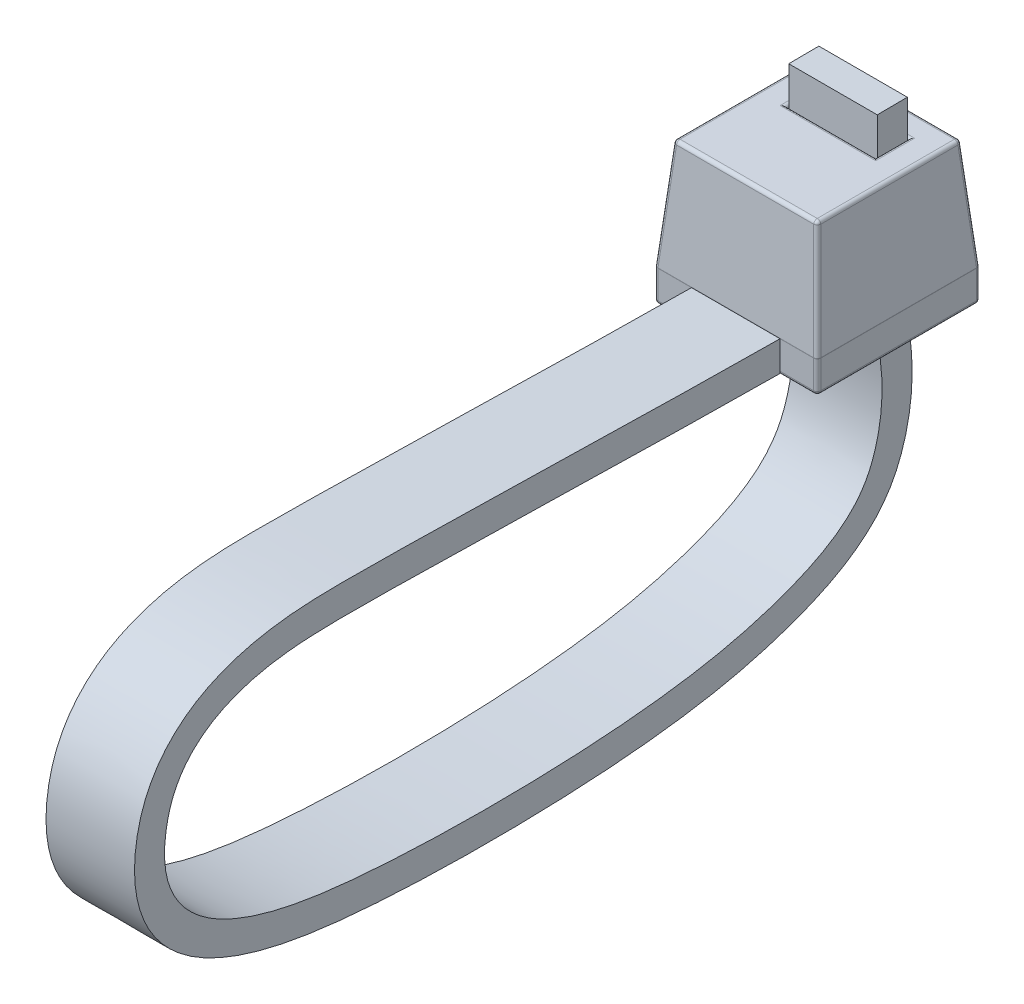
from build123d import *

# Parameters (mm, degrees)
SKETCH1_W    = 4.6
SKETCH1_H    = 4.6
BASE_DEPTH   = 0.9
SKETCH2_W    = 4.6
SKETCH2_H    = 4.6
LOCKER_DEPTH = 3.1
LOCKER_TAPER = 5
SKETCH3_W    = 2.5
SKETCH3_H    = 0.9
HOLE_DEPTH   = 6.155579669
FILLETALL_R  = 0.1
SWEEP7_START = -1.25
SWEEP7_DEPTH = 2.5


# Read off the part's stored shape, not the designer's step: Sweep7
with BuildPart() as part:
    # Sketch1 → Base (new body)
    with BuildSketch(Plane(origin=(0, 0, 0), x_dir=(1, 0, 0), z_dir=(0, 1, 0))):
        Rectangle(SKETCH1_W, SKETCH1_H)
    extrude(amount=BASE_DEPTH)

    # Sketch2 → Locker (add)
    with BuildSketch(Plane(origin=(0, 0.9, 0), x_dir=(1, 0, 0), z_dir=(0, 1, 0))):
        Rectangle(SKETCH2_W, SKETCH2_H)
    extrude(amount=LOCKER_DEPTH, taper=LOCKER_TAPER)

    # Sketch3 → Hole (cut, through all)
    with BuildSketch(Plane(origin=(0, 0, 0), x_dir=(-1, 0, 0), z_dir=(0, -1, 0))):
        with Locations((0, 0.85)):
            Rectangle(SKETCH3_W, SKETCH3_H)
    extrude(amount=-HOLE_DEPTH, mode=Mode.SUBTRACT)

    # FilletAll
    filletall_edges = [part.edges().sort_by_distance(p)[0] for p in [
        (2.3, 0.9, 0),
        (0, 0.9, -2.3),
        (2.164392572, 2.45, -2.164392572),
        (-2.164392572, 2.45, -2.164392572),
        (-2.164392572, 2.45, 2.164392572),
        (2.164392572, 2.45, 2.164392572),
        (0, 4, -2.028785143),
        (-2.028785143, 4, 0),
        (0, 4, 2.028785143),
        (2.028785143, 4, 0),
        (-1.25, 4, -0.85),
        (0, 4, -0.4),
        (1.25, 4, -0.85),
        (0, 4, -1.3),
        (-2.3, 0.9, 0),
        (0, 0, -2.3),
        (2.3, 0, 0),
        (0, 0, 2.3),
        (-2.3, 0, 0),
        (0, 0.9, 2.3),
        (-2.3, 0.45, -2.3),
        (2.3, 0.45, -2.3),
        (2.3, 0.45, 2.3),
        (-2.3, 0.45, 2.3),
    ]]
    fillet(filletall_edges, radius=FILLETALL_R)

    # Sweep7 outline → Sweep7 (add)
    with BuildSketch(Plane.YZ.offset(SWEEP7_START)):
        with BuildLine():
            Line((0.045633906, 2.3), (0.895633906, 2.3))
            add(Edge.make_bspline(
                [(0.895633906, 2.3), (0.910685665, 4.312859147), (0.965033252, 6.605294867), (1.063105539, 10.816606021), (1.107605545, 12.740682985), (1.120100516, 14.749516946), (1.117978372, 15.265934811), (1.059776902, 16.224894877), (1.002631008, 16.659365439), (0.75601356, 17.839465948), (0.489669675, 18.471166988), (-0.206220697, 19.473054212), (-0.638842832, 19.837590175), (-1.534415674, 20.317516889), (-1.991597612, 20.437073911), (-3.311169285, 20.617615549), (-4.251617088, 20.471372008), (-5.829798229, 19.260224827), (-6.421710861, 18.262739547), (-6.961699207, 16.032417144), (-7.08850332, 15.208429699), (-7.277560939, 12.824629336), (-7.335859628, 11.176803481), (-7.255772509, 7.54565374), (-7.121294878, 5.574750472), (-6.609481289, 3.094335223), (-6.399634125, 2.38705643), (-5.946961132, 1.187864729), (-5.70072461, 0.696620421), (-5.147571988, -0.116565934), (-4.837466719, -0.436237431), (-4.182103062, -0.907318554), (-3.842741468, -1.053232421), (-2.84205627, -1.389897942), (-2.134334215, -1.450754787), (-1.221961543, -1.41320427), (-0.942470744, -1.38133113), (-0.471584829, -1.32305491), (-0.271991055, -1.298305777), (-0.148843867, -1.295632638), (-0.125102282, -1.295611888), (-0.094080848, -1.295611888)],
                knots=[0, 0, 0, 0, 0.058571736, 0.058571736, 0.117143473, 0.117143473, 0.141601765, 0.141601765, 0.166060057, 0.166060057, 0.214976641, 0.214976641, 0.263893225, 0.263893225, 0.312809809, 0.312809809, 0.416524209, 0.416524209, 0.520238609, 0.520238609, 0.56718061, 0.56718061, 0.619334831, 0.619334831, 0.671489051, 0.671489051, 0.696633889, 0.696633889, 0.721778728, 0.721778728, 0.746923566, 0.746923566, 0.772068404, 0.772068404, 0.832655974, 0.832655974, 0.862949758, 0.862949758, 0.893243543, 0.893243543, 0.898782726, 0.898782726, 0.898782726, 0.898782726], degree=3))
            Line((-0.094080848, -1.295611888), (5.005919152, -1.295611888))
            Line((5.005919152, -1.295611888), (4.999595541, -0.44563541))
            Line((4.999595541, -0.44563541), (-0.100404459, -0.44563541))
            add(Edge.make_bspline(
                [(0.045633906, 2.3), (0.060680908, 4.323218275), (0.115138826, 6.618691469), (0.213213332, 10.830142713), (0.257591363, 12.752448575), (0.270107245, 14.743209737), (0.267573524, 15.243197144), (0.21405931, 16.132877716), (0.162023278, 16.525146263), (-0.055330328, 17.569714839), (-0.281273488, 18.089768132), (-0.825735712, 18.876380445), (-1.145986564, 19.14421197), (-1.821644239, 19.507907186), (-2.176746609, 19.604028863), (-3.261873314, 19.753974471), (-3.930753972, 19.644362381), (-5.108056884, 18.744485058), (-5.622662365, 17.947303715), (-6.121335901, 15.892916927), (-6.242886566, 15.11699734), (-6.427326001, 12.797324703), (-6.485319237, 11.170895828), (-6.407046215, 7.601488629), (-6.270599289, 5.661309812), (-5.787637028, 3.315894652), (-5.588190728, 2.645222306), (-5.172118581, 1.541006377), (-4.952861629, 1.10937568), (-4.49580384, 0.435579166), (-4.259114271, 0.195559319), (-3.775989757, -0.153176208), (-3.529768296, -0.261399113), (-2.689429396, -0.545245317), (-2.100662183, -0.598177758), (-1.29962183, -0.565944431), (-1.04685331, -0.537742029), (-0.588238726, -0.481075004), (-0.38131663, -0.451572626), (-0.163540253, -0.445633807), (-0.131181072, -0.44563541), (-0.100404459, -0.44563541)],
                knots=[0, 0, 0, 0, 0.058571736, 0.058571736, 0.117143473, 0.117143473, 0.141601765, 0.141601765, 0.166060057, 0.166060057, 0.214976641, 0.214976641, 0.263893225, 0.263893225, 0.312809809, 0.312809809, 0.416524209, 0.416524209, 0.520238609, 0.520238609, 0.56718061, 0.56718061, 0.619334831, 0.619334831, 0.671489051, 0.671489051, 0.696633889, 0.696633889, 0.721778728, 0.721778728, 0.746923566, 0.746923566, 0.772068404, 0.772068404, 0.832655974, 0.832655974, 0.862949758, 0.862949758, 0.893243543, 0.893243543, 0.898782726, 0.898782726, 0.898782726, 0.898782726], degree=3))
        make_face()
    extrude(amount=SWEEP7_DEPTH)


solid = part.part
